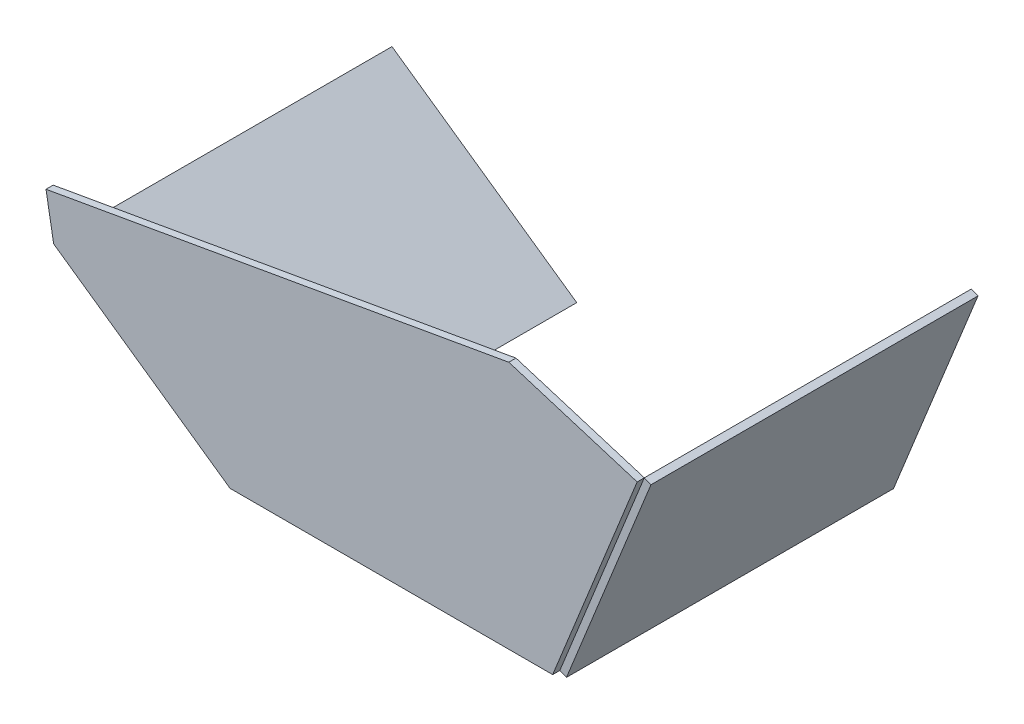
from build123d import *

# Parameters (mm, degrees)
BOSS_EXTRUDE1_DEPTH   = 290
BOSS_EXTRUDE1_2_DEPTH = 290
BOSS_EXTRUDE2_DEPTH   = 6.35


with BuildPart() as part:
    # Sketch1 → Boss-Extrude1 (new body)
    with BuildSketch(Plane.XY):
        Polygon((-137.5, 0), (-301.330408858, 114.71528727), (-304.972619229, 109.513671789), (-148.570887152, 0), align=None)
    extrude(amount=BOSS_EXTRUDE1_DEPTH)


with BuildPart() as body_2:
    # Sketch1 → Boss-Extrude1 2 (new body)
    with BuildSketch(Plane.XY):
        Polygon((137.5, 0), (143.387617476, -2.378751868), (218.30893616, 183.058019045), (212.421318683, 185.436770913), align=None)
    extrude(amount=BOSS_EXTRUDE1_2_DEPTH)


with BuildPart() as body_3:
    # Sketch2 → Boss-Extrude2 (new body)
    with BuildSketch(Plane.XY.offset(290)):
        Polygon((-311.778264202, 148.1104024), (98.624232146, 220.475435456), (212.421318683, 185.436770913), (137.5, 0), (-148.570887152, 0), (-304.972619229, 109.513671789), align=None)
    extrude(amount=BOSS_EXTRUDE2_DEPTH)


solid = Compound([part.part, body_2.part, body_3.part])
